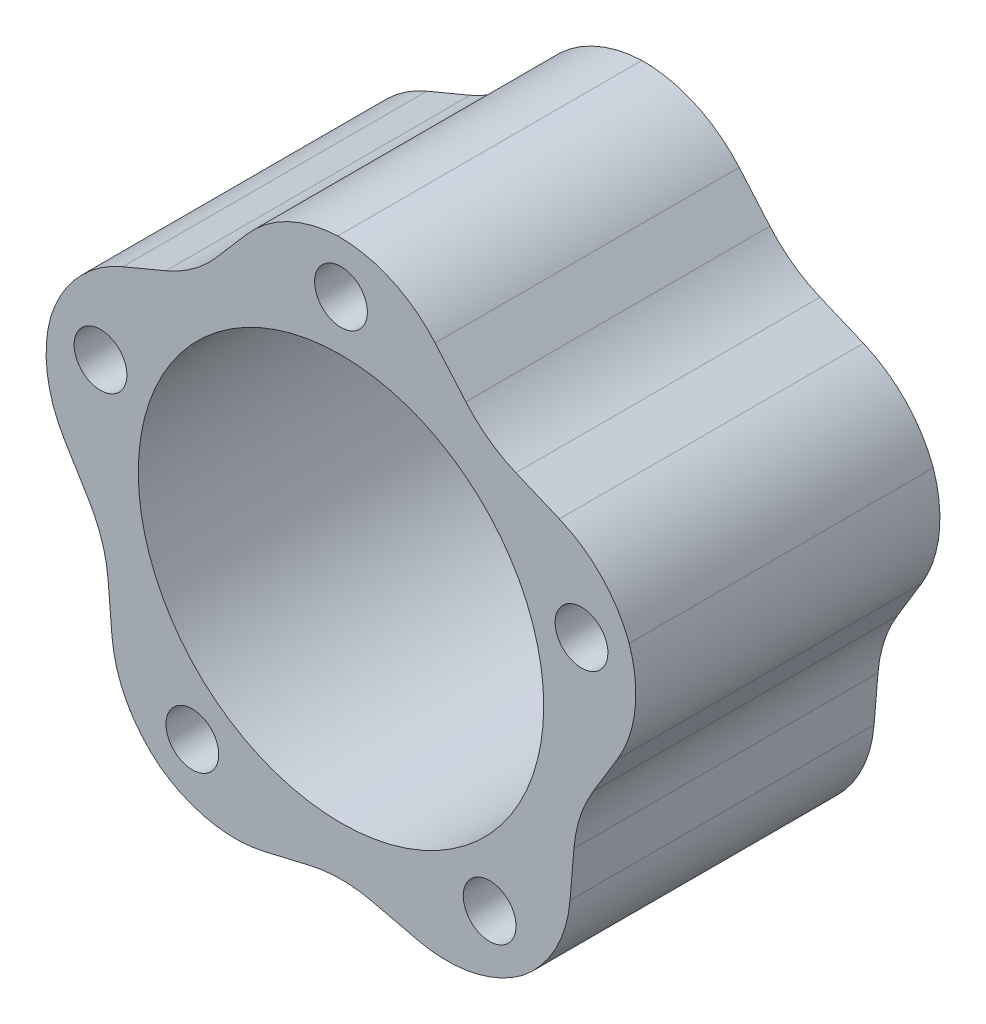
from build123d import *

# Parameters (mm, degrees)
SKETCH1_R                        = 57.15
SKETCH1_R_2                      = 38.1
BOSS_EXTRUDE1_DEPTH              = 28.575
F_25_64_0_39063_DIAMETER_HOLE2_D = 9.921875
CIRPATTERN2_COUNT                = 5
CUT_EXTRUDE2_DEPTH               = 99.986703653
FILLET1_R                        = 23.8125
FILLET2_R                        = 25.4
CIRPATTERN1_START                = -28.575
CIRPATTERN1_DEPTH                = 57.15


# Read off the part's stored shape, not the designer's step: CirPattern1
with BuildPart() as part:
    # Sketch1 → Boss-Extrude1 (new, symmetric)
    with BuildSketch(Plane.XY):
        Circle(SKETCH1_R)
        Circle(SKETCH1_R_2, mode=Mode.SUBTRACT)
    extrude(amount=BOSS_EXTRUDE1_DEPTH, both=True)

    # 25/64 (0.39063) Diameter Hole2 (through all)
    with Locations(Plane.XY.offset(28.575)):
        with Locations((0, 47.5234)):
            f_25_64_0_39063_diameter_hole2 = Hole(F_25_64_0_39063_DIAMETER_HOLE2_D / 2)

    # CirPattern2: 25/64 (0.39063) Diameter Hole2 ×5 about axis
    cirpattern2_axis = Axis((0, 0, 0), (0, 0, 1))
    for i in range(1, CIRPATTERN2_COUNT):
        add(f_25_64_0_39063_diameter_hole2.rotate(cirpattern2_axis, i * 360 / CIRPATTERN2_COUNT), mode=Mode.SUBTRACT)

    # Sketch5 → Cut-Extrude2 (cut, through all)
    with BuildSketch(Plane.XY.offset(28.575)):
        Polygon((0, -46.54915497), (88.85993875, -67.46875), (-88.85993875, -67.46875), align=None)
    extrude(amount=-CUT_EXTRUDE2_DEPTH, mode=Mode.SUBTRACT)

    # Fillet1
    fillet1_edges = [part.edges().sort_by_distance(p)[0] for p in [
        (23.519318129, -52.086122669, 0),
        (-23.519318129, -52.086122669, 0),
    ]]
    fillet(fillet1_edges, radius=FILLET1_R)

    # Fillet2
    fillet2_edges = [part.edges().sort_by_distance(p)[0] for p in [
        (0, -46.54915497, 0),
    ]]
    fillet(fillet2_edges, radius=FILLET2_R)

    # CirPattern1 outline → CirPattern1 (cut)
    with BuildSketch(Plane.XY.offset(CIRPATTERN1_START)):
        with BuildLine():
            ThreePointArc((-43.775443864, -20.343642549), (-44.931279172, -14.59905758), (-47.372771091, -9.272207766))
            Line((-47.372771091, -9.272207766), (-51.967174053, -1.7001118))
            ThreePointArc((-51.967174053, -1.7001118), (-55.202463072, 7.429620219), (-54.5340897, 17.092558633))
            ThreePointArc((-54.5340897, 17.092558633), (-54.352879906, -17.660321229), (-34.072251451, -45.882504084))
            ThreePointArc((-34.072251451, -45.882504084), (-40.292709561, -38.457882702), (-43.041627602, -29.170119173))
            Line((-43.041627602, -29.170119173), (-43.775443864, -20.343642549))
        make_face()
        with BuildLine():
            ThreePointArc((34.072251451, -45.882504084), (54.534089699, -17.092558633), (54.165759228, 18.226163261))
            ThreePointArc((54.165759228, 18.226163261), (55.264246489, 8.008560011), (51.954827504, -1.72046031))
            Line((51.954827504, -1.72046031), (47.372771091, -9.272207766))
            ThreePointArc((47.372771091, -9.272207766), (44.931279172, -14.59905758), (43.775443864, -20.343642549))
            Line((43.775443864, -20.343642549), (43.041627602, -29.170119173))
            ThreePointArc((43.041627602, -29.170119173), (40.292709561, -38.457882702), (34.072251451, -45.882504084))
        make_face()
        with BuildLine():
            ThreePointArc((54.165759228, 18.226163261), (33.107949758, 46.583110274), (-0.595971221, 57.146892464))
            ThreePointArc((-0.595971221, 57.146892464), (9.460998162, 55.034202885), (17.691179628, 48.880325777))
            Line((17.691179628, 48.880325777), (23.457384954, 42.188912866))
            ThreePointArc((23.457384954, 42.188912866), (27.769057686, 38.220828948), (32.875309902, 35.346389866))
            Line((32.875309902, 35.346389866), (41.043026315, 31.92095785))
            ThreePointArc((41.043026315, 31.92095785), (49.026751951, 26.436504665), (54.165759228, 18.226163261))
        make_face()
        with BuildLine():
            ThreePointArc((-0.595971221, 57.146892464), (-34.072251451, 45.882504084), (-54.5340897, 17.092558633))
            ThreePointArc((-54.5340897, 17.092558633), (-49.417028058, 26.004447915), (-41.021077193, 31.930163021))
            Line((-41.021077193, 31.930163021), (-32.875309902, 35.346389866))
            ThreePointArc((-32.875309902, 35.346389866), (-27.769057686, 38.220828948), (-23.457384954, 42.188912866))
            Line((-23.457384954, 42.188912866), (-17.675642338, 48.898356078))
            ThreePointArc((-17.675642338, 48.898356078), (-9.992510498, 54.796541129), (-0.595971221, 57.146892464))
        make_face()
    extrude(amount=CIRPATTERN1_DEPTH, mode=Mode.SUBTRACT)


solid = part.part
